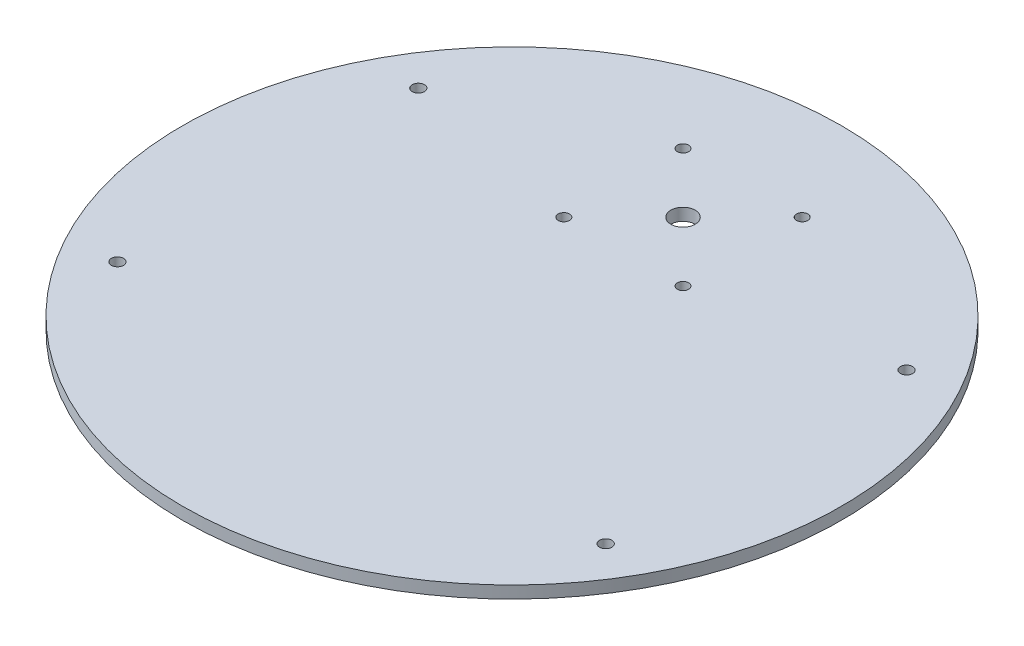
from build123d import *

# Parameters (mm, degrees)
SKETCH1_R           = 85.725
BOSS_EXTRUDE1_DEPTH = 3.175
CUT_EXTRUDE1_REACH  = 123.275
SKETCH2_R           = 1.5875
CUT_EXTRUDE2_REACH  = 123.275
SKETCH3_R           = 3.175
CUT_EXTRUDE3_REACH  = 123.275
SKETCH5_R           = 1.4732


with BuildPart() as part:
    # Sketch1 → Boss-Extrude1 (new body)
    with BuildSketch(Plane(origin=(0, 0, 0), x_dir=(1, 0, 0), z_dir=(0, 1, 0))):
        Circle(SKETCH1_R)
    extrude(amount=BOSS_EXTRUDE1_DEPTH)

    # Sketch2 → Cut-Extrude1 (cut, up to next)
    with BuildSketch(Plane(origin=(0, 3.175, 0), x_dir=(1, 0, 0), z_dir=(0, 1, 0)), mode=Mode.PRIVATE) as cut_extrude1_sk1:
        with Locations((-63.5, 39.13251)):
            Circle(SKETCH2_R)
    cut_extrude1_tool1 = extrude(cut_extrude1_sk1.sketch, amount=-CUT_EXTRUDE1_REACH, mode=Mode.PRIVATE) & part.part
    # Sketch2 → Cut-Extrude1 (cut, up to next)
    with BuildSketch(Plane(origin=(0, 3.175, 0), x_dir=(1, 0, 0), z_dir=(0, 1, 0)), mode=Mode.PRIVATE) as cut_extrude1_sk2:
        with Locations((63.5, 39.13251)):
            Circle(SKETCH2_R)
    cut_extrude1_tool2 = extrude(cut_extrude1_sk2.sketch, amount=-CUT_EXTRUDE1_REACH, mode=Mode.PRIVATE) & part.part
    # Sketch2 → Cut-Extrude1 (cut, up to next)
    with BuildSketch(Plane(origin=(0, 3.175, 0), x_dir=(1, 0, 0), z_dir=(0, 1, 0)), mode=Mode.PRIVATE) as cut_extrude1_sk3:
        with Locations((-63.5, -39.13251)):
            Circle(SKETCH2_R)
    cut_extrude1_tool3 = extrude(cut_extrude1_sk3.sketch, amount=-CUT_EXTRUDE1_REACH, mode=Mode.PRIVATE) & part.part
    # Sketch2 → Cut-Extrude1 (cut, up to next)
    with BuildSketch(Plane(origin=(0, 3.175, 0), x_dir=(1, 0, 0), z_dir=(0, 1, 0)), mode=Mode.PRIVATE) as cut_extrude1_sk4:
        with Locations((63.5, -39.13251)):
            Circle(SKETCH2_R)
    cut_extrude1_tool4 = extrude(cut_extrude1_sk4.sketch, amount=-CUT_EXTRUDE1_REACH, mode=Mode.PRIVATE) & part.part
    add(cut_extrude1_tool1.solids().sort_by_distance((-63.5, 3.175, -39.13251))[0], mode=Mode.SUBTRACT)
    add(cut_extrude1_tool2.solids().sort_by_distance((63.5, 3.175, -39.13251))[0], mode=Mode.SUBTRACT)
    add(cut_extrude1_tool3.solids().sort_by_distance((-63.5, 3.175, 39.13251))[0], mode=Mode.SUBTRACT)
    add(cut_extrude1_tool4.solids().sort_by_distance((63.5, 3.175, 39.13251))[0], mode=Mode.SUBTRACT)

    # Sketch3 → Cut-Extrude2 (cut, up to next)
    with BuildSketch(Plane(origin=(0, 3.175, 0), x_dir=(1, 0, 0), z_dir=(0, 1, 0)), mode=Mode.PRIVATE) as cut_extrude2_sk1:
        with Locations((0, 44.482150941)):
            Circle(SKETCH3_R)
    cut_extrude2_tool1 = extrude(cut_extrude2_sk1.sketch, amount=-CUT_EXTRUDE2_REACH, mode=Mode.PRIVATE) & part.part
    add(cut_extrude2_tool1.solids().sort_by_distance((0, 3.175, -44.482151))[0], mode=Mode.SUBTRACT)

    # Sketch5 → Cut-Extrude3 (cut, up to next)
    with BuildSketch(Plane(origin=(0, 3.175, 0), x_dir=(1, 0, 0), z_dir=(0, 1, 0)), mode=Mode.PRIVATE) as cut_extrude3_sk1:
        with Locations((-15.50035, 59.982500941)):
            Circle(SKETCH5_R)
    cut_extrude3_tool1 = extrude(cut_extrude3_sk1.sketch, amount=-CUT_EXTRUDE3_REACH, mode=Mode.PRIVATE) & part.part
    # Sketch5 → Cut-Extrude3 (cut, up to next)
    with BuildSketch(Plane(origin=(0, 3.175, 0), x_dir=(1, 0, 0), z_dir=(0, 1, 0)), mode=Mode.PRIVATE) as cut_extrude3_sk2:
        with Locations((15.50035, 59.982500941)):
            Circle(SKETCH5_R)
    cut_extrude3_tool2 = extrude(cut_extrude3_sk2.sketch, amount=-CUT_EXTRUDE3_REACH, mode=Mode.PRIVATE) & part.part
    # Sketch5 → Cut-Extrude3 (cut, up to next)
    with BuildSketch(Plane(origin=(0, 3.175, 0), x_dir=(1, 0, 0), z_dir=(0, 1, 0)), mode=Mode.PRIVATE) as cut_extrude3_sk3:
        with Locations((-15.50035, 28.981800941)):
            Circle(SKETCH5_R)
    cut_extrude3_tool3 = extrude(cut_extrude3_sk3.sketch, amount=-CUT_EXTRUDE3_REACH, mode=Mode.PRIVATE) & part.part
    # Sketch5 → Cut-Extrude3 (cut, up to next)
    with BuildSketch(Plane(origin=(0, 3.175, 0), x_dir=(1, 0, 0), z_dir=(0, 1, 0)), mode=Mode.PRIVATE) as cut_extrude3_sk4:
        with Locations((15.50035, 28.981800941)):
            Circle(SKETCH5_R)
    cut_extrude3_tool4 = extrude(cut_extrude3_sk4.sketch, amount=-CUT_EXTRUDE3_REACH, mode=Mode.PRIVATE) & part.part
    add(cut_extrude3_tool1.solids().sort_by_distance((-15.50035, 3.175, -59.982501))[0], mode=Mode.SUBTRACT)
    add(cut_extrude3_tool2.solids().sort_by_distance((15.50035, 3.175, -59.982501))[0], mode=Mode.SUBTRACT)
    add(cut_extrude3_tool3.solids().sort_by_distance((-15.50035, 3.175, -28.981801))[0], mode=Mode.SUBTRACT)
    add(cut_extrude3_tool4.solids().sort_by_distance((15.50035, 3.175, -28.981801))[0], mode=Mode.SUBTRACT)


solid = part.part
